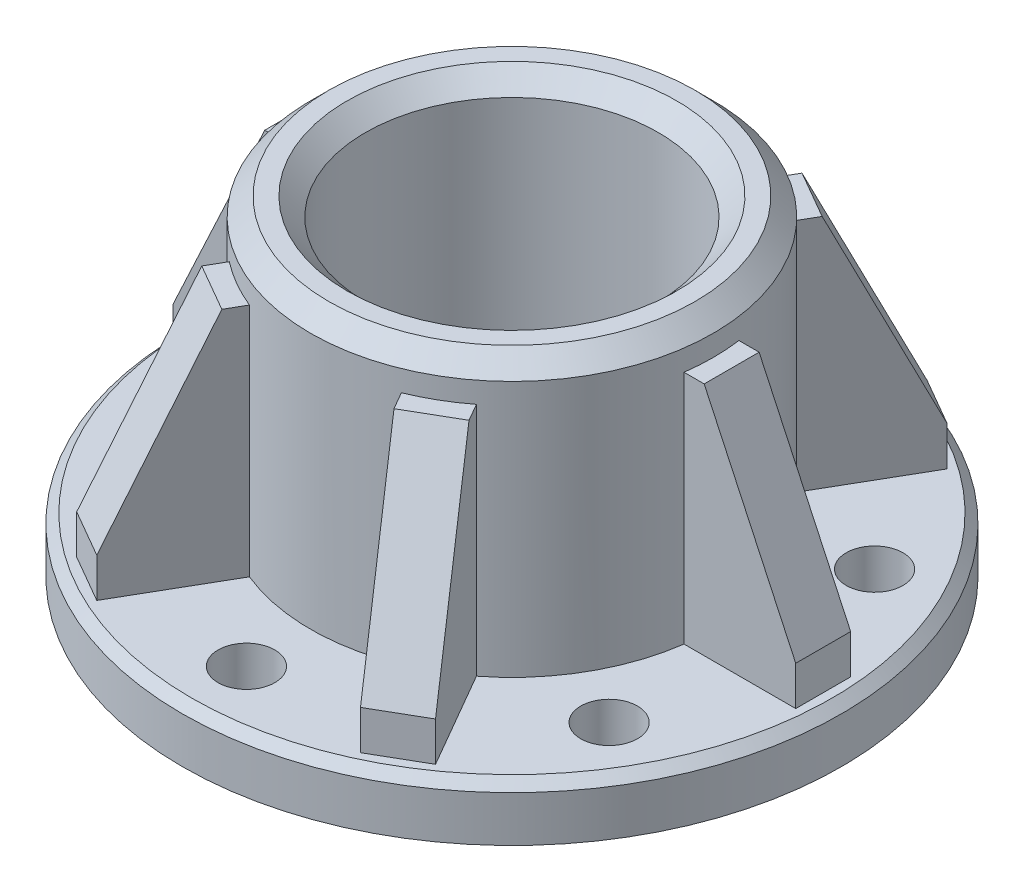
from build123d import *

# Parameters (mm, degrees)
SKETCH1_R                = 18
SKETCH1_R_2              = 8
BOSS_EXTRUDE1_DEPTH      = 3
SKETCH2_R                = 11
SKETCH2_R_2              = 8
BOSS_EXTRUDE2_DEPTH      = 15
M_0_295_DIAMETER_HOLE1_D = 3.099999896
BOSS_EXTRUDE3_DEPTH      = 1.5
CIRPATTERN1_COUNT        = 6
CHAMFER1_SIZE            = 1
CHAMFER2_SIZE            = 0.5


with BuildPart() as part:
    # Sketch1 → Boss-Extrude1 (new body)
    with BuildSketch(Plane(origin=(0, 0, 0), x_dir=(1, 0, 0), z_dir=(0, 1, 0))):
        Circle(SKETCH1_R)
        Circle(SKETCH1_R_2, mode=Mode.SUBTRACT)
    extrude(amount=BOSS_EXTRUDE1_DEPTH)

    # Sketch2 → Boss-Extrude2 (add)
    with BuildSketch(Plane(origin=(0, 3, 0), x_dir=(1, 0, 0), z_dir=(0, 1, 0))):
        Circle(SKETCH2_R)
        Circle(SKETCH2_R_2, mode=Mode.SUBTRACT)
    extrude(amount=BOSS_EXTRUDE2_DEPTH)

    # M (0.295) Diameter Hole1 (through all)
    with Locations(Plane(origin=(0, 3, 14.5), x_dir=(0, 0, 1), z_dir=(0, 1, 0))):
        with Locations((0, 0), (-7.25, -12.557368355), (-7.25, 12.557368355), (-21.75, 12.557368355), (-29, 0), (-21.75, -12.557368355)):
            Hole(M_0_295_DIAMETER_HOLE1_D / 2)

    # Sketch5 → Boss-Extrude3 (add, symmetric)
    with BuildSketch(Plane.XY):
        Polygon((12, 15.857142857), (17, 5.142857143), (17, 3), (17, 2.9), (10.9, 3), (10.9, 15.857142857), (11, 15.857142857), align=None)
    boss_extrude3 = extrude(amount=BOSS_EXTRUDE3_DEPTH, both=True)

    # CirPattern1: Boss-Extrude3 ×6 about axis
    cirpattern1_axis = Axis((0, 18, 0), (0, -1, 0))
    for i in range(1, CIRPATTERN1_COUNT):
        add(boss_extrude3.rotate(cirpattern1_axis, i * 360 / CIRPATTERN1_COUNT))

    # Chamfer1
    chamfer1_edges = [part.edges().sort_by_distance(p)[0] for p in [
        (-8, 18, 0),
        (-11, 18, 0),
    ]]
    chamfer(chamfer1_edges, length=CHAMFER1_SIZE)

    # Chamfer2
    chamfer2_edges = [part.edges().sort_by_distance(p)[0] for p in [
        (-18, 3, 0),
    ]]
    chamfer(chamfer2_edges, length=CHAMFER2_SIZE)


solid = part.part
